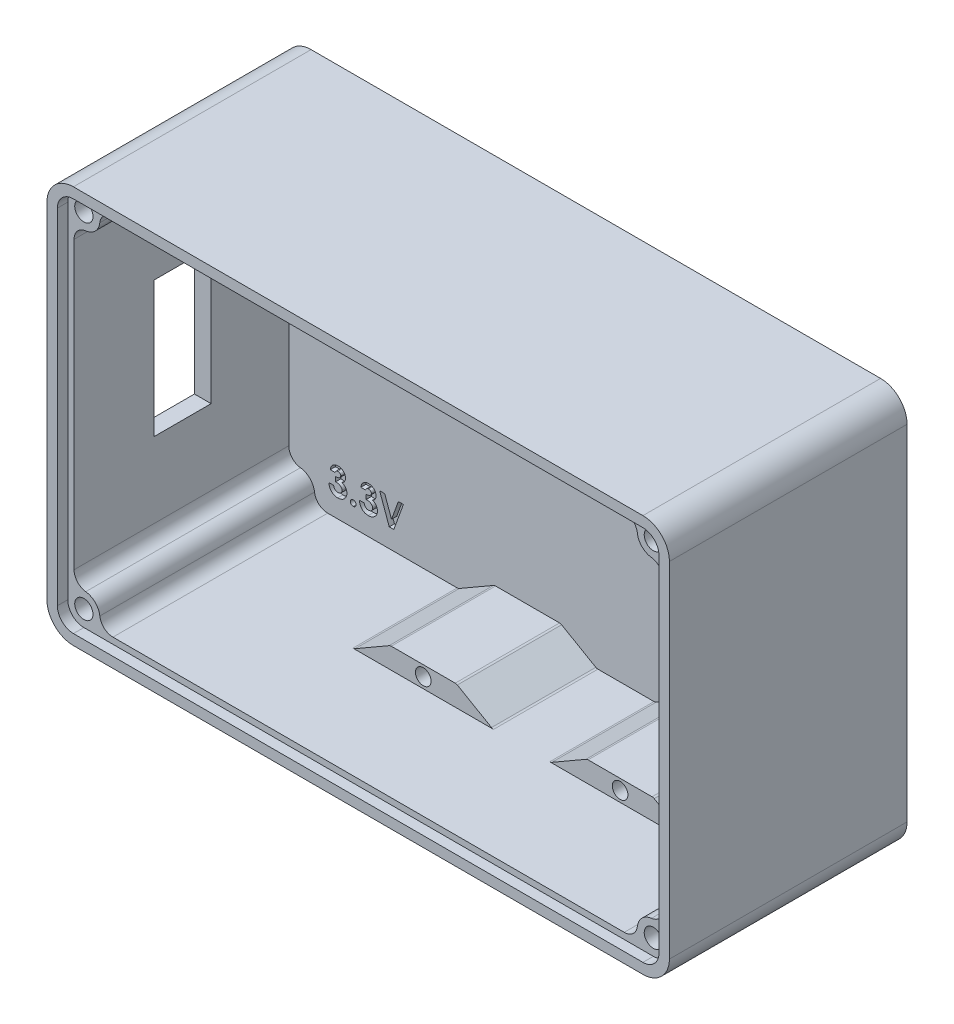
from build123d import *

# Parameters (mm, degrees)
ENCLOSURE_BASE_DEPTH    = 2.400000026
ENCLOSURE_START         = 2.4
ENCLOSURE_WALL_DEPTH    = 43.18
SKETCH7_W               = 11.000000098
SKETCH7_H               = 26.00000007
POWER_SWITCH_HOLE_DEPTH = 7.112
SKETCH8_W               = 0.569871795
SKETCH8_H               = 2.320192308
LABELING_DEPTH          = 1.000000032
TOP_START               = -2.000000064
TOP_COVER_GROOVE_DEPTH  = 2.000000064
SKETCH10_R              = 3.079999936
SKETCH10_R_2            = 1.750000056
BOSS_EXTRUDE4_DEPTH     = 43.579999962
FILLET1_R               = 2.54
SKETCH12_R              = 1.500000048
BOSS_EXTRUDE5_DEPTH     = 19.999999878
BOSS_EXTRUDE6_DEPTH     = 20.066
FILLET4_R               = 0.799999924


with BuildPart() as part:
    # Sketch5 → Enclosure Base (new body)
    with BuildSketch(Plane.XY):
        with BuildLine():
            Line((42.610000124, -38.1), (-66.609999876, -38.1))
            ThreePointArc((-66.609999876, -38.1), (-70.202102324, -36.612102448), (-71.689999876, -33.02))
            Line((-71.689999876, -33.02), (-71.689999876, 33.02))
            ThreePointArc((-71.689999876, 33.02), (-70.202102324, 36.612102448), (-66.609999876, 38.1))
            Line((-66.609999876, 38.1), (42.610000124, 38.1))
            ThreePointArc((42.610000124, 38.1), (46.202102572, 36.612102448), (47.690000124, 33.02))
            Line((47.690000124, 33.02), (47.690000124, -33.02))
            ThreePointArc((47.690000124, -33.02), (46.202102572, -36.612102448), (42.610000124, -38.1))
        make_face()
    extrude(amount=ENCLOSURE_BASE_DEPTH)

    # Sketch5<3> → Enclosure Wall (add)
    with BuildSketch(Plane.XY.offset(ENCLOSURE_START)):
        with BuildLine():
            Line((42.610000124, 38.1), (-66.609999876, 38.1))
            ThreePointArc((-66.609999876, 38.1), (-70.202102324, 36.612102448), (-71.689999876, 33.02))
            Line((-71.689999876, 33.02), (-71.689999876, -33.02))
            ThreePointArc((-71.689999876, -33.02), (-70.202102324, -36.612102448), (-66.609999876, -38.1))
            Line((-66.609999876, -38.1), (42.610000124, -38.1))
            ThreePointArc((42.610000124, -38.1), (46.202102572, -36.612102448), (47.690000124, -33.02))
            Line((47.690000124, -33.02), (47.690000124, 33.02))
            ThreePointArc((47.690000124, 33.02), (46.202102572, 36.612102448), (42.610000124, 38.1))
        make_face()
        with BuildLine():
            ThreePointArc((44.490000174, 33.02), (43.939360908, 34.349360784), (42.610000124, 34.90000005))
            Line((42.610000124, 34.90000005), (-66.609999876, 34.90000005))
            ThreePointArc((-66.609999876, 34.90000005), (-67.93936066, 34.349360784), (-68.489999926, 33.02))
            Line((-68.489999926, 33.02), (-68.489999926, -33.02))
            ThreePointArc((-68.489999926, -33.02), (-67.93936066, -34.349360784), (-66.609999876, -34.90000005))
            Line((-66.609999876, -34.90000005), (42.610000124, -34.90000005))
            ThreePointArc((42.610000124, -34.90000005), (43.939360908, -34.349360784), (44.490000174, -33.02))
            Line((44.490000174, -33.02), (44.490000174, 33.02))
        make_face(mode=Mode.SUBTRACT)
    extrude(amount=ENCLOSURE_WALL_DEPTH)

    # Sketch7 → Power Switch Hole (cut)
    with BuildSketch(Plane.ZY.offset(71.689999876)):
        with Locations((22.790000013, 0)):
            Rectangle(SKETCH7_W, SKETCH7_H)
    extrude(amount=-POWER_SWITCH_HOLE_DEPTH, mode=Mode.SUBTRACT)

    # Sketch8 → Labeling (cut)
    # profile 1 of 12: a face of its own
    with BuildSketch(Plane.XY.offset(2.400000026)):
        with BuildLine():
            Line((-59.62574043, -27.429839852), (-60.537535302, -27.429839852))
            add(Edge.make_bspline(
                [(-60.537535302, -27.429839852), (-60.531097683, -27.384262479), (-60.518477158, -27.294911058), (-60.48827793, -27.16555246), (-60.452156395, -27.042846977), (-60.407060504, -26.927183192), (-60.35417036, -26.818355069), (-60.294023796, -26.715989164), (-60.225970607, -26.62052485), (-60.173807117, -26.563016768), (-60.147783699, -26.534327031)],
                knots=[0, 0, 0, 0, 1.111473889, 2.178970933, 3.205615836, 4.199322666, 5.174200091, 6.12565194, 7.064921805, 8, 8, 8, 8], degree=3))
            add(Edge.make_bspline(
                [(-60.147783699, -26.534327031), (-60.110248367, -26.496473002), (-60.036270173, -26.421866688), (-59.912643935, -26.326304242), (-59.783060806, -26.243601443), (-59.64492194, -26.178034066), (-59.500376882, -26.12496487), (-59.34827616, -26.089318171), (-59.189241312, -26.065666272), (-59.080720035, -26.063336478), (-59.025339789, -26.062147544)],
                knots=[0, 0, 0, 0, 1.01925491, 2.00884431, 2.983262333, 3.955970413, 4.92937149, 5.924503185, 6.940838805, 8, 8, 8, 8], degree=3))
            add(Edge.make_bspline(
                [(-59.025339789, -26.062147544), (-58.9761039, -26.063309907), (-58.879316064, -26.065594878), (-58.7370623, -26.083937386), (-58.60143524, -26.116108103), (-58.471001267, -26.158170594), (-58.34767864, -26.215403643), (-58.228745509, -26.28183903), (-58.11752487, -26.363324794), (-58.013756487, -26.455395506), (-57.918425437, -26.554978995), (-57.835868329, -26.661425555), (-57.764892503, -26.771891752), (-57.70641781, -26.887295353), (-57.661458717, -27.007831635), (-57.630255773, -27.132804274), (-57.609832689, -27.26193751), (-57.607798016, -27.349707632), (-57.606766071, -27.394222864)],
                knots=[0, 0, 0, 0, 1.091422571, 2.145516843, 3.172569842, 4.178562979, 5.178154469, 6.181868002, 7.194278174, 8.227918432, 9.254613415, 10.245994977, 11.209837596, 12.161663635, 13.10878368, 14.055455738, 15.013766427, 16, 16, 16, 16], degree=3))
            add(Edge.make_bspline(
                [(-57.606766071, -27.394222864), (-57.608883684, -27.449351273), (-57.613052612, -27.557882161), (-57.647261688, -27.71672518), (-57.700808195, -27.868607452), (-57.778161332, -28.011403916), (-57.874872454, -28.144725961), (-57.993533763, -28.264116231), (-58.130765475, -28.371446603), (-58.233787149, -28.429125958), (-58.286541712, -28.458661967)],
                knots=[0, 0, 0, 0, 0.992805628, 1.954529043, 2.915727527, 3.886831945, 4.871318353, 5.87440735, 6.911542536, 8, 8, 8, 8], degree=3))
            add(Edge.make_bspline(
                [(-58.286541712, -28.458661967), (-58.250331789, -28.470550447), (-58.179180916, -28.493910777), (-58.078048504, -28.539918682), (-57.981883137, -28.590197697), (-57.892340747, -28.648608658), (-57.808530727, -28.712789685), (-57.730963993, -28.78328942), (-57.659177102, -28.859954142), (-57.594341945, -28.943205477), (-57.53679821, -29.031711982), (-57.485167281, -29.12342921), (-57.442672148, -29.219748068), (-57.40667348, -29.31956853), (-57.379266144, -29.423787731), (-57.35996893, -29.532001829), (-57.348814667, -29.64396398), (-57.347113452, -29.71981827), (-57.34625325, -29.758173185)],
                knots=[0, 0, 0, 0, 1.059543567, 2.081955587, 3.086750234, 4.076226789, 5.052108497, 6.020845489, 6.989030705, 7.970690546, 8.952259656, 9.923888338, 10.895517021, 11.877585046, 12.873342345, 13.889638361, 14.932918083, 16, 16, 16, 16], degree=3))
            add(Edge.make_bspline(
                [(-57.34625325, -29.758173185), (-57.347996994, -29.814539337), (-57.351435302, -29.92568191), (-57.373294455, -30.089383546), (-57.413992258, -30.245458511), (-57.467532473, -30.395702684), (-57.538949309, -30.538176467), (-57.622994918, -30.67614944), (-57.726303858, -30.804836737), (-57.841114006, -30.927640517), (-57.968617369, -31.039288215), (-58.106851757, -31.136081745), (-58.252777515, -31.219147816), (-58.407317873, -31.286583219), (-58.570419141, -31.338516191), (-58.74171778, -31.376055738), (-58.92193354, -31.399023054), (-59.044944896, -31.401430741), (-59.107767673, -31.402660364)],
                knots=[0, 0, 0, 0, 1.005138573, 1.981928558, 2.936866704, 3.876260664, 4.820238198, 5.773547, 6.751179199, 7.756627054, 8.768222608, 9.766606018, 10.760583154, 11.757261445, 12.767156078, 13.807575856, 14.880313354, 16, 16, 16, 16], degree=3))
            add(Edge.make_bspline(
                [(-59.107767673, -31.402660364), (-59.167197007, -31.401363935), (-59.283403205, -31.398828938), (-59.453379091, -31.376887255), (-59.614925081, -31.34149354), (-59.768453442, -31.291603163), (-59.913370188, -31.226903871), (-60.050989479, -31.149861531), (-60.178565151, -31.056032521), (-60.29751865, -30.949652458), (-60.405211228, -30.830300068), (-60.501463032, -30.70074009), (-60.584151692, -30.560479859), (-60.653616316, -30.410118627), (-60.709313848, -30.249392613), (-60.753247897, -30.078628664), (-60.78393655, -29.897493158), (-60.793282843, -29.772868077), (-60.798048122, -29.709327031)],
                knots=[0, 0, 0, 0, 1.066544725, 2.085487077, 3.070979577, 4.031932826, 4.977951092, 5.916076795, 6.857635327, 7.814973522, 8.776389752, 9.738577119, 10.707772778, 11.69409279, 12.707140348, 13.757286496, 14.856535458, 16, 16, 16, 16], degree=3))
            Line((-60.798048122, -29.709327031), (-59.88625325, -29.709327031))
            add(Edge.make_bspline(
                [(-59.88625325, -29.709327031), (-59.880475301, -29.741276303), (-59.86922123, -29.803505889), (-59.847270855, -29.893600495), (-59.818666454, -29.976763381), (-59.785592649, -30.053733697), (-59.749867961, -30.125522035), (-59.706703994, -30.189477076), (-59.659263578, -30.24733546), (-59.590806712, -30.316118144), (-59.492942907, -30.386789481), (-59.360794349, -30.448206235), (-59.213791591, -30.484203999), (-59.111022003, -30.488595615), (-59.057903891, -30.490865493)],
                knots=[0, 0, 0, 0, 0.928156231, 1.807827665, 2.648129825, 3.438902246, 4.202261636, 4.936546065, 5.639352463, 6.338805438, 7.70633318, 9.064371875, 10.482673459, 12, 12, 12, 12], degree=3))
            add(Edge.make_bspline(
                [(-59.057903891, -30.490865493), (-59.029717544, -30.490382144), (-58.974506794, -30.489435371), (-58.893410424, -30.478941664), (-58.816154713, -30.46165852), (-58.742595769, -30.438171369), (-58.67226531, -30.408728756), (-58.60650707, -30.370764269), (-58.543980732, -30.326625133), (-58.485366015, -30.277001026), (-58.431204808, -30.222928514), (-58.386139499, -30.163052394), (-58.344953068, -30.102207553), (-58.314491286, -30.036413309), (-58.287800203, -29.969210095), (-58.271463896, -29.898158644), (-58.259128812, -29.824749425), (-58.258411946, -29.774511378), (-58.258048122, -29.749014531)],
                knots=[0, 0, 0, 0, 1.110435564, 2.175094844, 3.216326037, 4.226890168, 5.215276772, 6.21526065, 7.213097102, 8.228249917, 9.239874822, 10.221364777, 11.178138315, 12.128914389, 13.072518965, 14.022636769, 14.996447288, 16, 16, 16, 16], degree=3))
            add(Edge.make_bspline(
                [(-58.258048122, -29.749014531), (-58.259014007, -29.721129385), (-58.260936863, -29.665616448), (-58.276646794, -29.584606989), (-58.301456096, -29.506682419), (-58.335919247, -29.432187824), (-58.381940944, -29.361397776), (-58.436246032, -29.292892012), (-58.503112857, -29.230236137), (-58.576474717, -29.168302702), (-58.661545656, -29.114315427), (-58.754182598, -29.064493103), (-58.856820186, -29.024849916), (-58.966952945, -28.989441206), (-59.086664139, -28.963579235), (-59.215210405, -28.944800923), (-59.352384381, -28.93082338), (-59.446940185, -28.928818071), (-59.49548402, -28.92778857)],
                knots=[0, 0, 0, 0, 0.809814727, 1.612155564, 2.388397, 3.182215007, 3.988903953, 4.837162975, 5.715530372, 6.646997145, 7.623086902, 8.637258368, 9.698941581, 10.815059213, 11.996518529, 13.252603015, 14.589518788, 16, 16, 16, 16], degree=3))
            Line((-59.49548402, -28.92778857), (-59.49548402, -28.081121903))
            add(Edge.make_bspline(
                [(-59.49548402, -28.081121903), (-59.435044058, -28.075974642), (-59.32197286, -28.066345137), (-59.165023974, -28.043826205), (-59.032893244, -28.013725945), (-58.922404905, -27.977411609), (-58.830662468, -27.930774542), (-58.750516781, -27.87928928), (-58.681491525, -27.819496671), (-58.623155924, -27.753179725), (-58.576489258, -27.681961543), (-58.54346131, -27.606949067), (-58.521651379, -27.530463277), (-58.51958489, -27.478149301), (-58.518560943, -27.452227672)],
                knots=[0, 0, 0, 0, 1.70044513, 3.18119609, 4.440695891, 5.496282586, 6.431922213, 7.318171381, 8.16090191, 8.983045123, 9.787564368, 10.536848927, 11.275007137, 12, 12, 12, 12], degree=3))
            add(Edge.make_bspline(
                [(-58.518560943, -27.452227672), (-58.520327545, -27.419154488), (-58.52377558, -27.354602636), (-58.550554883, -27.262215336), (-58.597040719, -27.179859715), (-58.659370062, -27.107709074), (-58.735320534, -27.047443451), (-58.824347801, -27.003691636), (-58.924519967, -26.977985491), (-58.994996484, -26.97532063), (-59.031445558, -26.973942416)],
                knots=[0, 0, 0, 0, 1.009664648, 1.970651636, 2.907870547, 3.878035693, 4.867062054, 5.849714035, 6.887914197, 8, 8, 8, 8], degree=3))
            add(Edge.make_bspline(
                [(-59.031445558, -26.973942416), (-59.064482546, -26.975568563), (-59.130038049, -26.978795338), (-59.225899815, -27.00287913), (-59.316936555, -27.043421198), (-59.401263156, -27.099326319), (-59.477662344, -27.166466), (-59.540364036, -27.245979016), (-59.59251633, -27.333101604), (-59.614622314, -27.397467356), (-59.62574043, -27.429839852)],
                knots=[0, 0, 0, 0, 0.98818071, 1.960853194, 2.938124878, 3.957524365, 4.978590984, 5.968022688, 6.978025184, 8, 8, 8, 8], degree=3))
        make_face()
    # profile 2 of 12: a face of its own
    with BuildSketch(Plane.XY.offset(2.400000026)):
        with BuildLine():
            add(Edge.make_bspline(
                [(-56.141381456, -30.230352672), (-56.104573378, -30.232370771), (-56.032104629, -30.236344058), (-55.927397169, -30.265996286), (-55.832898083, -30.319270738), (-55.748403274, -30.388758027), (-55.676956591, -30.472360513), (-55.625316544, -30.567698927), (-55.593158992, -30.672002935), (-55.589608775, -30.744699679), (-55.587791712, -30.781907159)],
                knots=[0, 0, 0, 0, 1.016957001, 2.002212695, 2.9757545, 3.99499976, 5.013036768, 5.994806404, 6.97370641, 8, 8, 8, 8], degree=3))
            add(Edge.make_bspline(
                [(-55.587791712, -30.781907159), (-55.589596872, -30.819120616), (-55.593123831, -30.891829035), (-55.625539071, -30.996336287), (-55.676879424, -31.092458295), (-55.748409006, -31.176956637), (-55.832548161, -31.247753479), (-55.927614439, -31.300536663), (-56.031905164, -31.331870986), (-56.104538269, -31.335626946), (-56.141381456, -31.337532159)],
                knots=[0, 0, 0, 0, 1.023218912, 1.999186227, 2.986238111, 4.008388923, 5.030539734, 6.0011649, 6.986089706, 8, 8, 8, 8], degree=3))
            add(Edge.make_bspline(
                [(-56.141381456, -31.337532159), (-56.178233372, -31.335642439), (-56.250883688, -31.331917021), (-56.355336525, -31.300272545), (-56.451104656, -31.24810588), (-56.535264951, -31.176870761), (-56.607114096, -31.092757511), (-56.656994795, -30.996033005), (-56.689711974, -30.891868435), (-56.693190717, -30.819133955), (-56.694971199, -30.781907159)],
                knots=[0, 0, 0, 0, 1.013427518, 1.99788335, 2.976245624, 3.997909735, 5.019573847, 6.001765691, 6.977268297, 8, 8, 8, 8], degree=3))
            add(Edge.make_bspline(
                [(-56.694971199, -30.781907159), (-56.69317897, -30.744686108), (-56.689677277, -30.671962848), (-56.657216688, -30.568005702), (-56.607034153, -30.472059671), (-56.535270943, -30.388844082), (-56.450752931, -30.318921088), (-56.355555014, -30.266256784), (-56.250684323, -30.236297683), (-56.178198305, -30.23235515), (-56.141381456, -30.230352672)],
                knots=[0, 0, 0, 0, 1.025808215, 2.00424526, 2.981110158, 3.998665696, 5.017428914, 5.998734231, 6.983523959, 8, 8, 8, 8], degree=3))
        make_face()
    # profile 3 of 12: a face of its own
    with BuildSketch(Plane.XY.offset(2.400000026)):
        with BuildLine():
            Line((-53.764201968, -27.429839852), (-54.67599684, -27.429839852))
            add(Edge.make_bspline(
                [(-54.67599684, -27.429839852), (-54.669559222, -27.384262479), (-54.656938697, -27.294911058), (-54.626739469, -27.16555246), (-54.590617934, -27.042846977), (-54.545522042, -26.927183192), (-54.492631898, -26.818355069), (-54.432485335, -26.715989164), (-54.364432146, -26.62052485), (-54.312268655, -26.563016768), (-54.286245238, -26.534327031)],
                knots=[0, 0, 0, 0, 1.111473889, 2.178970933, 3.205615836, 4.199322666, 5.174200091, 6.12565194, 7.064921805, 8, 8, 8, 8], degree=3))
            add(Edge.make_bspline(
                [(-54.286245238, -26.534327031), (-54.248709906, -26.496473002), (-54.174731712, -26.421866688), (-54.051105473, -26.326304242), (-53.921522344, -26.243601443), (-53.783383478, -26.178034066), (-53.638838421, -26.12496487), (-53.486737698, -26.089318171), (-53.327702851, -26.065666272), (-53.219181574, -26.063336478), (-53.163801327, -26.062147544)],
                knots=[0, 0, 0, 0, 1.01925491, 2.00884431, 2.983262333, 3.955970413, 4.92937149, 5.924503185, 6.940838805, 8, 8, 8, 8], degree=3))
            add(Edge.make_bspline(
                [(-53.163801327, -26.062147544), (-53.114565439, -26.063309907), (-53.017777603, -26.065594878), (-52.875523838, -26.083937386), (-52.739896778, -26.116108103), (-52.609462805, -26.158170594), (-52.486140178, -26.215403643), (-52.367207047, -26.28183903), (-52.255986408, -26.363324794), (-52.152218026, -26.455395506), (-52.056886975, -26.554978995), (-51.974329868, -26.661425555), (-51.903354041, -26.771891752), (-51.844879348, -26.887295353), (-51.799920255, -27.007831635), (-51.768717311, -27.132804274), (-51.748294227, -27.26193751), (-51.746259554, -27.349707632), (-51.745227609, -27.394222864)],
                knots=[0, 0, 0, 0, 1.091422571, 2.145516843, 3.172569842, 4.178562979, 5.178154469, 6.181868002, 7.194278174, 8.227918432, 9.254613415, 10.245994977, 11.209837596, 12.161663635, 13.10878368, 14.055455738, 15.013766427, 16, 16, 16, 16], degree=3))
            add(Edge.make_bspline(
                [(-51.745227609, -27.394222864), (-51.747345222, -27.449351273), (-51.751514151, -27.557882161), (-51.785723227, -27.71672518), (-51.839269733, -27.868607452), (-51.91662287, -28.011403916), (-52.013333993, -28.144725961), (-52.131995301, -28.264116231), (-52.269227014, -28.371446603), (-52.372248688, -28.429125958), (-52.42500325, -28.458661967)],
                knots=[0, 0, 0, 0, 0.992805628, 1.954529043, 2.915727527, 3.886831945, 4.871318353, 5.87440735, 6.911542536, 8, 8, 8, 8], degree=3))
            add(Edge.make_bspline(
                [(-52.42500325, -28.458661967), (-52.388793328, -28.470550447), (-52.317642454, -28.493910777), (-52.216510043, -28.539918682), (-52.120344675, -28.590197697), (-52.030802285, -28.648608658), (-51.946992265, -28.712789685), (-51.869425532, -28.78328942), (-51.79763864, -28.859954142), (-51.732803484, -28.943205477), (-51.675259749, -29.031711982), (-51.623628819, -29.12342921), (-51.581133687, -29.219748068), (-51.545135019, -29.31956853), (-51.517727683, -29.423787731), (-51.498430469, -29.532001829), (-51.487276206, -29.64396398), (-51.48557499, -29.71981827), (-51.484714789, -29.758173185)],
                knots=[0, 0, 0, 0, 1.059543567, 2.081955587, 3.086750234, 4.076226789, 5.052108497, 6.020845489, 6.989030705, 7.970690546, 8.952259656, 9.923888338, 10.895517021, 11.877585046, 12.873342345, 13.889638361, 14.932918083, 16, 16, 16, 16], degree=3))
            add(Edge.make_bspline(
                [(-51.484714789, -29.758173185), (-51.486458533, -29.814539337), (-51.489896841, -29.92568191), (-51.511755993, -30.089383546), (-51.552453797, -30.245458511), (-51.605994011, -30.395702684), (-51.677410847, -30.538176467), (-51.761456456, -30.67614944), (-51.864765396, -30.804836737), (-51.979575545, -30.927640517), (-52.107078908, -31.039288215), (-52.245313296, -31.136081745), (-52.391239053, -31.219147816), (-52.545779412, -31.286583219), (-52.708880679, -31.338516191), (-52.880179318, -31.376055738), (-53.060395079, -31.399023054), (-53.183406435, -31.401430741), (-53.246229212, -31.402660364)],
                knots=[0, 0, 0, 0, 1.005138573, 1.981928558, 2.936866704, 3.876260664, 4.820238198, 5.773547, 6.751179199, 7.756627054, 8.768222608, 9.766606018, 10.760583154, 11.757261445, 12.767156078, 13.807575856, 14.880313354, 16, 16, 16, 16], degree=3))
            add(Edge.make_bspline(
                [(-53.246229212, -31.402660364), (-53.305658546, -31.401363935), (-53.421864744, -31.398828938), (-53.591840629, -31.376887255), (-53.753386619, -31.34149354), (-53.906914981, -31.291603163), (-54.051831727, -31.226903871), (-54.189451017, -31.149861531), (-54.31702669, -31.056032521), (-54.435980189, -30.949652458), (-54.543672767, -30.830300068), (-54.63992457, -30.70074009), (-54.72261323, -30.560479859), (-54.792077855, -30.410118627), (-54.847775386, -30.249392613), (-54.891709436, -30.078628664), (-54.922398088, -29.897493158), (-54.931744382, -29.772868077), (-54.936509661, -29.709327031)],
                knots=[0, 0, 0, 0, 1.066544725, 2.085487077, 3.070979577, 4.031932826, 4.977951092, 5.916076795, 6.857635327, 7.814973522, 8.776389752, 9.738577119, 10.707772778, 11.69409279, 12.707140348, 13.757286496, 14.856535458, 16, 16, 16, 16], degree=3))
            Line((-54.936509661, -29.709327031), (-54.024714789, -29.709327031))
            add(Edge.make_bspline(
                [(-54.024714789, -29.709327031), (-54.01893684, -29.741276303), (-54.007682769, -29.803505889), (-53.985732394, -29.893600495), (-53.957127992, -29.976763381), (-53.924054188, -30.053733697), (-53.888329499, -30.125522035), (-53.845165533, -30.189477076), (-53.797725117, -30.24733546), (-53.729268251, -30.316118144), (-53.631404446, -30.386789481), (-53.499255887, -30.448206235), (-53.35225313, -30.484203999), (-53.249483542, -30.488595615), (-53.19636543, -30.490865493)],
                knots=[0, 0, 0, 0, 0.928156231, 1.807827665, 2.648129825, 3.438902246, 4.202261636, 4.936546065, 5.639352463, 6.338805438, 7.70633318, 9.064371875, 10.482673459, 12, 12, 12, 12], degree=3))
            add(Edge.make_bspline(
                [(-53.19636543, -30.490865493), (-53.168179082, -30.490382144), (-53.112968333, -30.489435371), (-53.031871963, -30.478941664), (-52.954616252, -30.46165852), (-52.881057307, -30.438171369), (-52.810726848, -30.408728756), (-52.744968608, -30.370764269), (-52.682442271, -30.326625133), (-52.623827554, -30.277001026), (-52.569666347, -30.222928514), (-52.524601038, -30.163052394), (-52.483414606, -30.102207553), (-52.452952825, -30.036413309), (-52.426261741, -29.969210095), (-52.409925435, -29.898158644), (-52.39759035, -29.824749425), (-52.396873485, -29.774511378), (-52.396509661, -29.749014531)],
                knots=[0, 0, 0, 0, 1.110435564, 2.175094844, 3.216326037, 4.226890168, 5.215276772, 6.21526065, 7.213097102, 8.228249917, 9.239874822, 10.221364777, 11.178138315, 12.128914389, 13.072518965, 14.022636769, 14.996447288, 16, 16, 16, 16], degree=3))
            add(Edge.make_bspline(
                [(-52.396509661, -29.749014531), (-52.397475546, -29.721129385), (-52.399398401, -29.665616448), (-52.415108332, -29.584606989), (-52.439917634, -29.506682419), (-52.474380785, -29.432187824), (-52.520402482, -29.361397776), (-52.574707571, -29.292892012), (-52.641574395, -29.230236137), (-52.714936256, -29.168302702), (-52.800007194, -29.114315427), (-52.892644136, -29.064493103), (-52.995281724, -29.024849916), (-53.105414483, -28.989441206), (-53.225125677, -28.963579235), (-53.353671944, -28.944800923), (-53.490845919, -28.93082338), (-53.585401723, -28.928818071), (-53.633945558, -28.92778857)],
                knots=[0, 0, 0, 0, 0.809814727, 1.612155564, 2.388397, 3.182215007, 3.988903953, 4.837162975, 5.715530372, 6.646997145, 7.623086902, 8.637258368, 9.698941581, 10.815059213, 11.996518529, 13.252603015, 14.589518788, 16, 16, 16, 16], degree=3))
            Line((-53.633945558, -28.92778857), (-53.633945558, -28.081121903))
            add(Edge.make_bspline(
                [(-53.633945558, -28.081121903), (-53.573505597, -28.075974642), (-53.460434399, -28.066345137), (-53.303485513, -28.043826205), (-53.171354783, -28.013725945), (-53.060866444, -27.977411609), (-52.969124006, -27.930774542), (-52.88897832, -27.87928928), (-52.819953063, -27.819496671), (-52.761617462, -27.753179725), (-52.714950796, -27.681961543), (-52.681922849, -27.606949067), (-52.660112918, -27.530463277), (-52.658046429, -27.478149301), (-52.657022481, -27.452227672)],
                knots=[0, 0, 0, 0, 1.70044513, 3.18119609, 4.440695891, 5.496282586, 6.431922213, 7.318171381, 8.16090191, 8.983045123, 9.787564368, 10.536848927, 11.275007137, 12, 12, 12, 12], degree=3))
            add(Edge.make_bspline(
                [(-52.657022481, -27.452227672), (-52.658789084, -27.419154488), (-52.662237118, -27.354602636), (-52.689016421, -27.262215336), (-52.735502257, -27.179859715), (-52.7978316, -27.107709074), (-52.873782072, -27.047443451), (-52.96280934, -27.003691636), (-53.062981506, -26.977985491), (-53.133458022, -26.97532063), (-53.169907097, -26.973942416)],
                knots=[0, 0, 0, 0, 1.009664648, 1.970651636, 2.907870547, 3.878035693, 4.867062054, 5.849714035, 6.887914197, 8, 8, 8, 8], degree=3))
            add(Edge.make_bspline(
                [(-53.169907097, -26.973942416), (-53.202944084, -26.975568563), (-53.268499587, -26.978795338), (-53.364361353, -27.00287913), (-53.455398094, -27.043421198), (-53.539724694, -27.099326319), (-53.616123883, -27.166466), (-53.678825574, -27.245979016), (-53.730977868, -27.333101604), (-53.753083853, -27.397467356), (-53.764201968, -27.429839852)],
                knots=[0, 0, 0, 0, 0.98818071, 1.960853194, 2.938124878, 3.957524365, 4.978590984, 5.968022688, 6.978025184, 8, 8, 8, 8], degree=3))
        make_face()
    # profile 4 of 12: a face of its own
    with BuildSketch(Plane.XY.offset(2.400000026)):
        Polygon((-51.061381456, -26.192403954), (-50.087511263, -26.192403954), (-48.781894276, -29.80091357), (-47.473224404, -26.192403954), (-46.502407097, -26.192403954), (-48.344314148, -31.272403954), (-49.222527289, -31.272403954), align=None)
    # profile 5 of 12: a face of its own
    with BuildSketch(Plane.XY.offset(2.400000026)):
        with BuildLine():
            Line((-59.854706776, 30.957596046), (-57.541637866, 30.957596046))
            Line((-57.541637866, 30.957596046), (-57.541637866, 30.110929379))
            Line((-57.541637866, 30.110929379), (-59.13219075, 30.110929379))
            Line((-59.13219075, 30.110929379), (-59.33062825, 29.150288354))
            add(Edge.make_bspline(
                [(-59.33062825, 29.150288354), (-59.3035883, 29.157819321), (-59.250259963, 29.172671936), (-59.169920758, 29.18756723), (-59.092060871, 29.197221886), (-59.040969689, 29.198509688), (-59.016181135, 29.199134507)],
                knots=[0, 0, 0, 0, 1.05461699, 2.079921384, 3.068411212, 4, 4, 4, 4], degree=3))
            add(Edge.make_bspline(
                [(-59.016181135, 29.199134507), (-58.962164279, 29.197896742), (-58.855685156, 29.195456835), (-58.699919711, 29.172294155), (-58.550765096, 29.135813637), (-58.40867774, 29.083784891), (-58.273796444, 29.016068134), (-58.145957704, 28.934149841), (-58.025004621, 28.837886133), (-57.91308583, 28.727216741), (-57.81025017, 28.605699243), (-57.720840429, 28.47426521), (-57.64447893, 28.334788765), (-57.583743634, 28.186402925), (-57.535806161, 28.030039653), (-57.501165472, 27.865598746), (-57.480680702, 27.692885317), (-57.477918456, 27.575055293), (-57.476509661, 27.514959828)],
                knots=[0, 0, 0, 0, 1.01440847, 1.999622559, 2.951875003, 3.895578053, 4.836219714, 5.782137149, 6.743708247, 7.735272588, 8.734977101, 9.730283169, 10.717124674, 11.717316708, 12.737475749, 13.78628267, 14.87096371, 16, 16, 16, 16], degree=3))
            add(Edge.make_bspline(
                [(-57.476509661, 27.514959828), (-57.478231232, 27.45418214), (-57.481628395, 27.334249995), (-57.50379177, 27.15790732), (-57.542910525, 26.989010847), (-57.596644048, 26.827108443), (-57.667434527, 26.673390055), (-57.752569765, 26.526263273), (-57.853489171, 26.386820173), (-57.96920238, 26.256490216), (-58.094997817, 26.137366133), (-58.228940262, 26.032572448), (-58.370088729, 25.944389412), (-58.518446624, 25.87312261), (-58.673162772, 25.816737586), (-58.834284128, 25.775691979), (-59.002593724, 25.752154604), (-59.116854071, 25.748962262), (-59.174931135, 25.747339636)],
                knots=[0, 0, 0, 0, 1.06808661, 2.107647099, 3.116961351, 4.110378221, 5.100014249, 6.085620622, 7.093190682, 8.119403071, 9.144090782, 10.133780668, 11.103064255, 12.062861538, 13.020824475, 13.992378307, 14.979551724, 16, 16, 16, 16], degree=3))
            add(Edge.make_bspline(
                [(-59.174931135, 25.747339636), (-59.226867725, 25.748667045), (-59.329297549, 25.751284974), (-59.480172183, 25.767376146), (-59.625632084, 25.795825489), (-59.76490502, 25.836999055), (-59.899456374, 25.887674315), (-60.027730694, 25.951053304), (-60.150432871, 26.025929201), (-60.267214475, 26.11093552), (-60.376177972, 26.20669184), (-60.475628307, 26.311513632), (-60.566167563, 26.424079666), (-60.645858343, 26.545778666), (-60.71445084, 26.676430829), (-60.775280066, 26.814496388), (-60.825069397, 26.961417189), (-60.850336048, 27.063270851), (-60.863176327, 27.115031943)],
                knots=[0, 0, 0, 0, 1.054957082, 2.080596141, 3.077793124, 4.061112343, 5.027190972, 5.994718051, 6.962465889, 7.943658696, 8.924948258, 9.904494768, 10.875059, 11.855380583, 12.854004648, 13.869083016, 14.917087635, 16, 16, 16, 16], degree=3))
            Line((-60.863176327, 27.115031943), (-59.821125045, 27.115031943))
            add(Edge.make_bspline(
                [(-59.821125045, 27.115031943), (-59.802076323, 27.079163614), (-59.765057304, 27.00945761), (-59.694638947, 26.916912416), (-59.615810066, 26.83799385), (-59.529281742, 26.771930862), (-59.434493325, 26.722437595), (-59.335307263, 26.684904191), (-59.230477524, 26.663215027), (-59.159083843, 26.660503666), (-59.123032097, 26.659134507)],
                knots=[0, 0, 0, 0, 1.104910296, 2.147267069, 3.153527244, 4.136738762, 5.099945312, 6.05603338, 7.018353, 8, 8, 8, 8], degree=3))
            add(Edge.make_bspline(
                [(-59.123032097, 26.659134507), (-59.097904513, 26.660079923), (-59.048465568, 26.661940045), (-58.975625101, 26.671780558), (-58.906095675, 26.690418265), (-58.839360355, 26.716227157), (-58.775239874, 26.748413761), (-58.71465342, 26.789047251), (-58.656546899, 26.835817904), (-58.601804928, 26.889487387), (-58.55222448, 26.949316377), (-58.508747852, 27.013606705), (-58.46987375, 27.080929826), (-58.441079108, 27.153952578), (-58.417498731, 27.230494477), (-58.400133188, 27.3111329), (-58.389755318, 27.395962027), (-58.388794604, 27.453872495), (-58.388304532, 27.483413354)],
                knots=[0, 0, 0, 0, 0.978869489, 1.925942215, 2.855067702, 3.774946051, 4.70828698, 5.642468714, 6.60995405, 7.609372294, 8.622401667, 9.629904756, 10.629323, 11.642352373, 12.678539694, 13.745912462, 14.850161547, 16, 16, 16, 16], degree=3))
            add(Edge.make_bspline(
                [(-58.388304532, 27.483413354), (-58.388873318, 27.512268502), (-58.389980472, 27.568435749), (-58.399139071, 27.650909387), (-58.41552363, 27.729161944), (-58.437847731, 27.803792775), (-58.466425246, 27.874348687), (-58.501348879, 27.941249662), (-58.542767828, 28.00415754), (-58.590904463, 28.061791579), (-58.642236875, 28.114655158), (-58.69738438, 28.160889223), (-58.755850128, 28.199260287), (-58.815817369, 28.232759342), (-58.879679778, 28.257139225), (-58.946001347, 28.27392875), (-59.01471233, 28.286248228), (-59.0615786, 28.286972043), (-59.085379853, 28.287339636)],
                knots=[0, 0, 0, 0, 1.166249705, 2.270133367, 3.348514167, 4.393962215, 5.415026464, 6.420877785, 7.440098956, 8.453121383, 9.451844239, 10.415694839, 11.355045125, 12.27538808, 13.187007209, 14.108269027, 15.039275622, 16, 16, 16, 16], degree=3))
            add(Edge.make_bspline(
                [(-59.085379853, 28.287339636), (-59.111233546, 28.286358632), (-59.163049893, 28.284392489), (-59.240036016, 28.268394513), (-59.3160939, 28.242503786), (-59.391646505, 28.206783424), (-59.465943842, 28.160036742), (-59.540946653, 28.105208244), (-59.614144432, 28.038314119), (-59.660685617, 27.988491222), (-59.684762866, 27.962716238)],
                knots=[0, 0, 0, 0, 0.88288272, 1.769486374, 2.674910571, 3.623812639, 4.617874466, 5.670434592, 6.794841017, 8, 8, 8, 8], degree=3))
            Line((-59.684762866, 27.962716238), (-60.452054532, 28.138765918))
            Line((-60.452054532, 28.138765918), (-59.854706776, 30.957596046))
        make_face()
    # profile 6 of 12: a face of its own
    with BuildSketch(Plane.XY.offset(2.400000026)):
        with BuildLine():
            add(Edge.make_bspline(
                [(-56.141381456, 26.919647328), (-56.104573378, 26.917629229), (-56.032104629, 26.913655942), (-55.927397169, 26.884003714), (-55.832898083, 26.830729262), (-55.748403274, 26.761241973), (-55.676956591, 26.677639487), (-55.625316544, 26.582301073), (-55.593158992, 26.477997065), (-55.589608775, 26.405300321), (-55.587791712, 26.368092841)],
                knots=[0, 0, 0, 0, 1.016957001, 2.002212695, 2.9757545, 3.99499976, 5.013036768, 5.994806404, 6.97370641, 8, 8, 8, 8], degree=3))
            add(Edge.make_bspline(
                [(-55.587791712, 26.368092841), (-55.589596872, 26.330879384), (-55.593123831, 26.258170965), (-55.625539071, 26.153663713), (-55.676879424, 26.057541705), (-55.748409006, 25.973043363), (-55.832548161, 25.902246521), (-55.927614439, 25.849463337), (-56.031905164, 25.818129014), (-56.104538269, 25.814373054), (-56.141381456, 25.812467841)],
                knots=[0, 0, 0, 0, 1.023218912, 1.999186227, 2.986238111, 4.008388923, 5.030539734, 6.0011649, 6.986089706, 8, 8, 8, 8], degree=3))
            add(Edge.make_bspline(
                [(-56.141381456, 25.812467841), (-56.178233372, 25.814357561), (-56.250883688, 25.818082979), (-56.355336525, 25.849727455), (-56.451104656, 25.90189412), (-56.535264951, 25.973129239), (-56.607114096, 26.057242489), (-56.656994795, 26.153966995), (-56.689711974, 26.258131565), (-56.693190717, 26.330866045), (-56.694971199, 26.368092841)],
                knots=[0, 0, 0, 0, 1.013427518, 1.99788335, 2.976245624, 3.997909735, 5.019573847, 6.001765691, 6.977268297, 8, 8, 8, 8], degree=3))
            add(Edge.make_bspline(
                [(-56.694971199, 26.368092841), (-56.69317897, 26.405313892), (-56.689677277, 26.478037152), (-56.657216688, 26.581994298), (-56.607034153, 26.677940329), (-56.535270943, 26.761155918), (-56.450752931, 26.831078912), (-56.355555014, 26.883743216), (-56.250684323, 26.913702317), (-56.178198305, 26.91764485), (-56.141381456, 26.919647328)],
                knots=[0, 0, 0, 0, 1.025808215, 2.00424526, 2.981110158, 3.998665696, 5.017428914, 5.998734231, 6.983523959, 8, 8, 8, 8], degree=3))
        make_face()
    # profile 7 of 12: a face of its own
    with BuildSketch(Plane.XY.offset(2.400000026)):
        with BuildLine():
            add(Edge.make_bspline(
                [(-53.225876648, 31.087852456), (-53.181741992, 31.087197265), (-53.094961466, 31.085908983), (-52.967150086, 31.071955847), (-52.84403239, 31.050876549), (-52.725126725, 31.021478279), (-52.611288987, 30.982570715), (-52.501690642, 30.935999029), (-52.397636226, 30.879320438), (-52.297798713, 30.81529906), (-52.202216561, 30.742817783), (-52.113187021, 30.660185385), (-52.029084222, 30.569303241), (-51.951728682, 30.468797376), (-51.879407338, 30.359581997), (-51.812357827, 30.241639786), (-51.751093428, 30.114393495), (-51.694927514, 29.977613498), (-51.644703776, 29.829249522), (-51.602400384, 29.667599768), (-51.566118147, 29.492627319), (-51.535493379, 29.303896644), (-51.512346004, 29.101156874), (-51.496744207, 28.884542699), (-51.486037515, 28.65447172), (-51.48516371, 28.496644919), (-51.484714789, 28.415560789)],
                knots=[0, 0, 0, 0, 0.879237366, 1.728815576, 2.559023295, 3.367336655, 4.166867292, 4.954216142, 5.737608147, 6.525189134, 7.316157332, 8.124696809, 8.942788509, 9.781158001, 10.649253743, 11.551476218, 12.482711956, 13.461909668, 14.496590415, 15.601789533, 16.789733467, 18.056700938, 19.410929216, 20.8549011, 22.384193279, 24, 24, 24, 24], degree=3))
            add(Edge.make_bspline(
                [(-51.484714789, 28.415560789), (-51.485199951, 28.333462206), (-51.486142613, 28.173946132), (-51.496299126, 27.941770807), (-51.513789123, 27.723583883), (-51.536331493, 27.519407934), (-51.567208374, 27.329350781), (-51.603369493, 27.152920305), (-51.646340631, 26.990180457), (-51.698218723, 26.841497924), (-51.754044663, 26.704477711), (-51.815476646, 26.57747952), (-51.881443922, 26.46015937), (-51.950433399, 26.350747325), (-52.026227335, 26.252468799), (-52.105136625, 26.161981806), (-52.19059712, 26.082733113), (-52.279010604, 26.010638597), (-52.373616019, 25.948334468), (-52.473437725, 25.893844303), (-52.58025537, 25.849646308), (-52.69212185, 25.811205253), (-52.810943951, 25.783608723), (-52.934833607, 25.761711783), (-53.065189506, 25.749610191), (-53.153941053, 25.748108909), (-53.199418314, 25.747339636)],
                knots=[0, 0, 0, 0, 1.643780988, 3.193836972, 4.651895693, 6.025988579, 7.305620092, 8.505800249, 9.631074763, 10.672816429, 11.65661981, 12.592235626, 13.49536222, 14.350718032, 15.179365177, 15.97804903, 16.751647189, 17.51006938, 18.259804725, 19.016521909, 19.783502495, 20.571750527, 21.382245291, 22.22305063, 23.089471752, 24, 24, 24, 24], degree=3))
            add(Edge.make_bspline(
                [(-53.199418314, 25.747339636), (-53.244894348, 25.748123748), (-53.333981229, 25.749659812), (-53.464689624, 25.761621803), (-53.589235833, 25.783697428), (-53.708998008, 25.811417118), (-53.823142623, 25.849561254), (-53.932216998, 25.895081621), (-54.035382447, 25.949231794), (-54.132924617, 26.011681086), (-54.224510472, 26.083293235), (-54.311563255, 26.163302268), (-54.393890402, 26.251505383), (-54.470239511, 26.348890528), (-54.54186096, 26.454157814), (-54.608007851, 26.568509343), (-54.668640431, 26.691778621), (-54.725655299, 26.824137473), (-54.775194002, 26.968435433), (-54.819281147, 27.125961065), (-54.855396177, 27.298027473), (-54.884442301, 27.48457938), (-54.907632709, 27.685221568), (-54.924883708, 27.90005088), (-54.935096636, 28.129167379), (-54.936029412, 28.286650562), (-54.936509661, 28.367732264)],
                knots=[0, 0, 0, 0, 0.917216111, 1.796812873, 2.643793957, 3.46689424, 4.273913431, 5.068098542, 5.848489301, 6.620921603, 7.401012384, 8.190319798, 9.003608147, 9.831726257, 10.68377682, 11.569763213, 12.493818149, 13.453288342, 14.474581811, 15.568529029, 16.750744269, 18.018426408, 19.375425659, 20.823733699, 22.36466933, 24, 24, 24, 24], degree=3))
            add(Edge.make_bspline(
                [(-54.936509661, 28.367732264), (-54.935639736, 28.480388906), (-54.933961204, 28.697761348), (-54.912689618, 29.011801326), (-54.881468324, 29.302076887), (-54.83561164, 29.568102469), (-54.778910485, 29.810863356), (-54.706301702, 30.028760364), (-54.623641885, 30.224808589), (-54.553205102, 30.340948737), (-54.519282097, 30.396882905)],
                knots=[0, 0, 0, 0, 1.288568992, 2.486310467, 3.599230591, 4.627010532, 5.572937695, 6.447898582, 7.252493626, 8, 8, 8, 8], degree=3))
            add(Edge.make_bspline(
                [(-54.519282097, 30.396882905), (-54.479838042, 30.451832614), (-54.402717143, 30.559270123), (-54.267869094, 30.700315489), (-54.122992424, 30.820944393), (-53.965111446, 30.918426895), (-53.796723115, 30.995301603), (-53.616381731, 31.049597344), (-53.424753265, 31.081232573), (-53.2931588, 31.085612877), (-53.225876648, 31.087852456)],
                knots=[0, 0, 0, 0, 1.058512271, 2.069600068, 3.047294572, 4.004278952, 4.967380941, 5.939006123, 6.946246673, 8, 8, 8, 8], degree=3))
        make_face()
        with BuildLine():
            add(Edge.make_bspline(
                [(-53.203488827, 30.176057584), (-53.243386922, 30.174166494), (-53.321608368, 30.170458953), (-53.435111413, 30.13898716), (-53.542137697, 30.09037728), (-53.623549733, 30.03188289), (-53.684485833, 29.975809001), (-53.727062322, 29.925063956), (-53.768120636, 29.868436143), (-53.804385406, 29.80337024), (-53.838628815, 29.732204141), (-53.872094948, 29.654614796), (-53.89952839, 29.568696441), (-53.926481018, 29.475912279), (-53.950094036, 29.373697073), (-53.969876568, 29.261215326), (-53.987550522, 29.13773556), (-53.999878315, 29.003176894), (-54.011371518, 28.857680112), (-54.01961039, 28.700921101), (-54.023054856, 28.532942154), (-54.024149747, 28.417257545), (-54.024714789, 28.357555982)],
                knots=[0, 0, 0, 0, 1.076674018, 2.110852608, 3.161083442, 4.239746716, 4.804137807, 5.395870207, 6.026861976, 6.692161227, 7.405688833, 8.16177676, 8.973626916, 9.841385931, 10.773283133, 11.807421078, 12.927755683, 14.143907515, 15.458935494, 16.872852025, 18.386167141, 20, 20, 20, 20], degree=3))
            add(Edge.make_bspline(
                [(-54.024714789, 28.357555982), (-54.023784798, 28.28020972), (-54.022001471, 28.13189253), (-54.012661239, 27.918607245), (-53.99393952, 27.724500462), (-53.97065348, 27.548256646), (-53.937947287, 27.391018787), (-53.900316695, 27.251299268), (-53.85384626, 27.130879174), (-53.800140717, 27.028016959), (-53.74065941, 26.940512286), (-53.676089833, 26.86613292), (-53.608630351, 26.801723899), (-53.536175334, 26.749405244), (-53.458897637, 26.709310639), (-53.377442387, 26.680471085), (-53.291757821, 26.662817193), (-53.233081913, 26.660369165), (-53.203488827, 26.659134507)],
                knots=[0, 0, 0, 0, 1.771748488, 3.397459088, 4.888034009, 6.237357457, 7.467047327, 8.564189669, 9.548206622, 10.417051504, 11.216568818, 11.965764335, 12.669334354, 13.348544111, 14.005342236, 14.656555988, 15.322436492, 16, 16, 16, 16], degree=3))
            add(Edge.make_bspline(
                [(-53.203488827, 26.659134507), (-53.174911282, 26.659979352), (-53.118960003, 26.661633453), (-53.037370507, 26.678612578), (-52.960213682, 26.706216946), (-52.887722488, 26.745265264), (-52.819637636, 26.794921174), (-52.756291881, 26.855402886), (-52.698162964, 26.927313262), (-52.664296793, 26.980681396), (-52.646846199, 27.008180982)],
                knots=[0, 0, 0, 0, 0.992283464, 1.942767638, 2.88273346, 3.832339453, 4.79467288, 5.803907806, 6.868395428, 8, 8, 8, 8], degree=3))
            add(Edge.make_bspline(
                [(-52.646846199, 27.008180982), (-52.626301063, 27.045758286), (-52.58321958, 27.124554846), (-52.533365613, 27.257521103), (-52.491401323, 27.407485064), (-52.455283272, 27.574913432), (-52.430580728, 27.760466564), (-52.409306927, 27.962967854), (-52.399046044, 28.183437013), (-52.397377056, 28.336178843), (-52.396509661, 28.415560789)],
                knots=[0, 0, 0, 0, 0.710965849, 1.490837728, 2.352621235, 3.297892224, 4.334225155, 5.461620853, 6.680770821, 8, 8, 8, 8], degree=3))
            add(Edge.make_bspline(
                [(-52.396509661, 28.415560789), (-52.396844717, 28.49563181), (-52.397489642, 28.649754855), (-52.409322163, 28.871016617), (-52.425799851, 29.073102515), (-52.449901953, 29.255561373), (-52.480913687, 29.418836122), (-52.519135767, 29.562916088), (-52.564196755, 29.688085225), (-52.617633718, 29.794218722), (-52.676818474, 29.884417635), (-52.739644899, 29.961801306), (-52.806378649, 30.027869532), (-52.876908124, 30.082870939), (-52.952865752, 30.12489614), (-53.032800644, 30.154569408), (-53.116876673, 30.17252074), (-53.174228428, 30.174862723), (-53.203488827, 30.176057584)],
                knots=[0, 0, 0, 0, 1.793836731, 3.452829483, 4.963243077, 6.335886805, 7.574563692, 8.684454726, 9.672768357, 10.54971625, 11.340229787, 12.085688095, 12.778991901, 13.440269426, 14.083255152, 14.715733572, 15.344777694, 16, 16, 16, 16], degree=3))
        make_face(mode=Mode.SUBTRACT)
    # profile 8 of 12: a face of its own
    with BuildSketch(Plane.XY.offset(2.400000026)):
        Polygon((-51.061381456, 30.957596046), (-50.087511263, 30.957596046), (-48.781894276, 27.34908643), (-47.473224404, 30.957596046), (-46.502407097, 30.957596046), (-48.344314148, 25.877596046), (-49.222527289, 25.877596046), align=None)
    # profile 9 of 12: a face of its own
    with BuildSketch(Plane.XY.offset(2.400000026)):
        Polygon((-37.305816346, 3.175), (-36.697147476, 3.175), (-35.881136859, 0.91968149), (-35.063218189, 3.175), (-34.456457371, 3.175), (-35.607649279, 0), (-36.156532492, 0), align=None)
    # profile 10 of 12: a face of its own
    with BuildSketch(Plane.XY.offset(2.400000026)):
        with BuildLine():
            add(Edge.make_bspline(
                [(-33.786094791, 3.297115385), (-33.761533321, 3.295910306), (-33.713304508, 3.293544018), (-33.644210169, 3.270477972), (-33.58079557, 3.234276503), (-33.524735305, 3.184607225), (-33.478109619, 3.125293022), (-33.442485864, 3.058886828), (-33.422641353, 2.985310904), (-33.419885245, 2.934485425), (-33.418476602, 2.908508614)],
                knots=[0, 0, 0, 0, 0.989868614, 1.943702388, 2.910836514, 3.924849579, 4.949916355, 5.946401046, 6.950409252, 8, 8, 8, 8], degree=3))
            add(Edge.make_bspline(
                [(-33.418476602, 2.908508614), (-33.419834846, 2.882723237), (-33.422481448, 2.832479203), (-33.442942597, 2.759902107), (-33.477136539, 2.693528166), (-33.524139864, 2.635094889), (-33.579592362, 2.586225564), (-33.641621304, 2.549366879), (-33.710053518, 2.527583993), (-33.757533966, 2.525019896), (-33.781642668, 2.523717949)],
                knots=[0, 0, 0, 0, 1.05296456, 2.051751585, 3.055639087, 4.085634717, 5.099016424, 6.062201612, 7.016062274, 8, 8, 8, 8], degree=3))
            add(Edge.make_bspline(
                [(-33.781642668, 2.523717949), (-33.80641854, 2.524918719), (-33.855066942, 2.52727648), (-33.924727996, 2.550396495), (-33.988988384, 2.586312854), (-34.044805459, 2.636996953), (-34.091965113, 2.696732628), (-34.12603281, 2.764684816), (-34.147342996, 2.83876385), (-34.149872497, 2.890342089), (-34.15116891, 2.916776843)],
                knots=[0, 0, 0, 0, 0.989065327, 1.942068821, 2.907541208, 3.917690034, 4.939857478, 5.938239964, 6.943311734, 8, 8, 8, 8], degree=3))
            add(Edge.make_bspline(
                [(-34.15116891, 2.916776843), (-34.149758058, 2.942124368), (-34.146986642, 2.991915923), (-34.127023261, 3.063856038), (-34.092216357, 3.12914584), (-34.04592652, 3.187374241), (-33.990358654, 3.236117001), (-33.926982123, 3.271219008), (-33.858352792, 3.29333236), (-33.810429491, 3.295841356), (-33.786094791, 3.297115385)],
                knots=[0, 0, 0, 0, 1.038616768, 2.040212704, 3.031499824, 4.052181184, 5.074969369, 6.039807101, 7.004644834, 8, 8, 8, 8], degree=3))
        make_face()
    # profile 11 of 12: a face of its own
    with BuildSketch(Plane.XY.offset(2.400000026)):
        with Locations((-33.784822757, 1.160096154)):
            Rectangle(SKETCH8_W, SKETCH8_H)
    # profile 12 of 12: a face of its own
    with BuildSketch(Plane.XY.offset(2.400000026)):
        with BuildLine():
            Line((-32.970720192, 2.320192308), (-32.400848397, 2.320192308))
            Line((-32.400848397, 2.320192308), (-32.400848397, 2.074689503))
            add(Edge.make_bspline(
                [(-32.400848397, 2.074689503), (-32.368337494, 2.099977153), (-32.306202837, 2.148306769), (-32.211747432, 2.209927275), (-32.122593223, 2.260361185), (-32.036752869, 2.298723797), (-31.952611281, 2.326324047), (-31.868805725, 2.346153181), (-31.784088168, 2.35885032), (-31.727137405, 2.36021543), (-31.698684936, 2.360897436)],
                knots=[0, 0, 0, 0, 1.276643801, 2.439914479, 3.493451431, 4.44993799, 5.350072675, 6.235028322, 7.118224225, 8, 8, 8, 8], degree=3))
            add(Edge.make_bspline(
                [(-31.698684936, 2.360897436), (-31.669823734, 2.360118044), (-31.613166772, 2.358588033), (-31.529742516, 2.347886845), (-31.450038742, 2.328396591), (-31.373159246, 2.302518806), (-31.299886529, 2.268361613), (-31.229322957, 2.227805489), (-31.162984209, 2.178405385), (-31.122129871, 2.140784638), (-31.101464383, 2.121754808)],
                knots=[0, 0, 0, 0, 1.048836932, 2.058954983, 3.049370783, 4.026390553, 5.001981509, 5.982488534, 6.97947532, 8, 8, 8, 8], degree=3))
            add(Edge.make_bspline(
                [(-31.101464383, 2.121754808), (-31.0848899, 2.10411972), (-31.05161963, 2.068720476), (-31.009753174, 2.008143303), (-30.973827047, 1.942103097), (-30.944390577, 1.869838062), (-30.922638212, 1.790951149), (-30.90590382, 1.706395199), (-30.896513861, 1.615696762), (-30.895354627, 1.553387791), (-30.894758654, 1.521354167)],
                knots=[0, 0, 0, 0, 0.889584746, 1.785680191, 2.700364693, 3.65222533, 4.649950538, 5.707241244, 6.821271309, 8, 8, 8, 8], degree=3))
            Line((-30.894758654, 1.521354167), (-30.894758654, 0))
            Line((-30.894758654, 0), (-31.464630448, 0))
            Line((-31.464630448, 0), (-31.464630448, 1.007451923))
            add(Edge.make_bspline(
                [(-31.464630448, 1.007451923), (-31.464750964, 1.04031325), (-31.464981909, 1.103285883), (-31.466755057, 1.193409185), (-31.470217275, 1.27480223), (-31.473372997, 1.347613213), (-31.479568933, 1.411583603), (-31.485156528, 1.467118384), (-31.493730152, 1.513713739), (-31.504885827, 1.563834035), (-31.524366383, 1.617496978), (-31.554608996, 1.674039753), (-31.592975992, 1.722074101), (-31.637900309, 1.761936766), (-31.689332332, 1.793471791), (-31.74665058, 1.815658645), (-31.809547759, 1.829486038), (-31.853373774, 1.830963488), (-31.876133854, 1.831730769)],
                knots=[0, 0, 0, 0, 1.49886392, 2.872294502, 4.110984203, 5.214877267, 6.195405875, 7.042225351, 7.75923308, 8.355011229, 9.382752534, 10.352059385, 11.267231453, 12.171456522, 13.078624015, 14.003401117, 14.963110155, 16, 16, 16, 16], degree=3))
            add(Edge.make_bspline(
                [(-31.876133854, 1.831730769), (-31.905734295, 1.830229723), (-31.963638512, 1.827293385), (-32.047385378, 1.805150715), (-32.12430548, 1.767492551), (-32.193770316, 1.715381225), (-32.255118291, 1.651043335), (-32.305646112, 1.574313021), (-32.347089305, 1.487042165), (-32.364910494, 1.423320264), (-32.374135657, 1.390334535)],
                knots=[0, 0, 0, 0, 0.984188326, 1.925263693, 2.85911992, 3.81709677, 4.80007086, 5.801799564, 6.862098548, 8, 8, 8, 8], degree=3))
            add(Edge.make_bspline(
                [(-32.374135657, 1.390334535), (-32.376428476, 1.379975146), (-32.381541925, 1.356871626), (-32.385747089, 1.317840753), (-32.391596778, 1.271534401), (-32.393788512, 1.217114556), (-32.397599698, 1.154838765), (-32.399009256, 1.084624637), (-32.400421337, 1.00660985), (-32.400701328, 0.952119486), (-32.400848397, 0.923497596)],
                knots=[0, 0, 0, 0, 0.543362196, 1.211806945, 2.009705693, 2.934833164, 4.000995085, 5.207458376, 6.533175157, 8, 8, 8, 8], degree=3))
            Line((-32.400848397, 0.923497596), (-32.400848397, 0))
            Line((-32.400848397, 0), (-32.970720192, 0))
            Line((-32.970720192, 0), (-32.970720192, 2.320192308))
        make_face()
    extrude(amount=-LABELING_DEPTH, mode=Mode.SUBTRACT)

    # Sketch9 → Top Cover Groove (cut)
    with BuildSketch(Plane.XY.offset(45.580000026).offset(TOP_START)):
        with BuildLine():
            Line((42.610000124, 36.099999936), (-66.609999876, 36.099999936))
            ThreePointArc((-66.609999876, 36.099999936), (-68.787888717, 35.197888841), (-69.689999812, 33.02))
            Line((-69.689999812, 33.02), (-69.689999812, -33.02))
            ThreePointArc((-69.689999812, -33.02), (-68.787888717, -35.197888841), (-66.609999876, -36.099999936))
            Line((-66.609999876, -36.099999936), (42.610000124, -36.099999936))
            ThreePointArc((42.610000124, -36.099999936), (44.787888965, -35.197888841), (45.69000006, -33.02))
            Line((45.69000006, -33.02), (45.69000006, 33.02))
            ThreePointArc((45.69000006, 33.02), (44.787888965, 35.197888841), (42.610000124, 36.099999936))
        make_face()
        with BuildLine():
            Line((44.490000174, -33.02), (44.490000174, 33.02))
            ThreePointArc((44.490000174, 33.02), (43.939360908, 34.349360784), (42.610000124, 34.90000005))
            Line((42.610000124, 34.90000005), (-66.609999876, 34.90000005))
            ThreePointArc((-66.609999876, 34.90000005), (-67.93936066, 34.349360784), (-68.489999926, 33.02))
            Line((-68.489999926, 33.02), (-68.489999926, -33.02))
            ThreePointArc((-68.489999926, -33.02), (-67.93936066, -34.349360784), (-66.609999876, -34.90000005))
            Line((-66.609999876, -34.90000005), (42.610000124, -34.90000005))
            ThreePointArc((42.610000124, -34.90000005), (43.939360908, -34.349360784), (44.490000174, -33.02))
        make_face(mode=Mode.SUBTRACT)
    extrude(amount=TOP_COVER_GROOVE_DEPTH, mode=Mode.SUBTRACT)

    # Sketch10 → Boss-Extrude4 (add)
    # profile 1 of 4: a face of its own
    with BuildSketch(Plane.XY):
        with Locations((-66.609999876, 33.02)):
            Circle(SKETCH10_R)
        with Locations((-66.609999876, 33.02)):
            Circle(SKETCH10_R_2, mode=Mode.SUBTRACT)
    # profile 2 of 4: a face of its own
    with BuildSketch(Plane.XY):
        with Locations((-66.609999876, -33.02)):
            Circle(SKETCH10_R)
        with Locations((-66.609999876, -33.02)):
            Circle(SKETCH10_R_2, mode=Mode.SUBTRACT)
    # profile 3 of 4: a face of its own
    with BuildSketch(Plane.XY):
        with Locations((42.610000124, 33.02)):
            Circle(SKETCH10_R)
        with Locations((42.610000124, 33.02)):
            Circle(SKETCH10_R_2, mode=Mode.SUBTRACT)
    # profile 4 of 4: a face of its own
    with BuildSketch(Plane.XY):
        with Locations((42.610000124, -33.02)):
            Circle(SKETCH10_R)
        with Locations((42.610000124, -33.02)):
            Circle(SKETCH10_R_2, mode=Mode.SUBTRACT)
    extrude(amount=BOSS_EXTRUDE4_DEPTH)

    # Fillet1
    fillet1_edges = [part.edges().sort_by_distance(p)[0] for p in [
        (-64.170327886, 34.90000005, 22.989999981),
        (-68.489999926, 30.58032801, 22.989999981),
        (-68.489999926, -30.58032801, 22.989999981),
        (-64.170327886, -34.90000005, 22.989999981),
        (40.170328134, 34.90000005, 22.989999981),
        (44.490000174, 30.58032801, 22.989999981),
        (44.490000174, -30.58032801, 22.989999981),
        (40.170328134, -34.90000005, 22.989999981),
    ]]
    fillet(fillet1_edges, radius=FILLET1_R)

    # Sketch12 → Boss-Extrude5 (add)
    # profile 1 of 2: a face of its own
    with BuildSketch(Plane.XY.offset(2.400000026)):
        Polygon((-35.974513721, 34.90000005), (-29.046310269, 30.899999922), (-16.346310269, 30.899999922), (-9.418106817, 34.90000005), align=None)
        with Locations((-22.696310269, 32.898591383)):
            Circle(SKETCH12_R, mode=Mode.SUBTRACT)
    # profile 2 of 2: a face of its own
    with BuildSketch(Plane.XY.offset(2.400000026)):
        Polygon((1.775486279, 34.90000005), (8.703689731, 30.899999922), (21.403689731, 30.899999922), (28.331893183, 34.90000005), align=None)
        with Locations((15.053689731, 32.898591383)):
            Circle(SKETCH12_R, mode=Mode.SUBTRACT)
    boss_extrude5 = extrude(amount=BOSS_EXTRUDE5_DEPTH)

    # Sketch12<3> → Boss-Extrude6 (add)
    with BuildSketch(Plane.XY.offset(2.400000026)):
        Polygon((40.328689631, 19.249999981), (34.328689693, 25.249999919), (34.328689693, 5.250000041), (40.328689631, 11.249999979), (44.490000174, 11.249999979), (44.490000174, 19.249999981), align=None)
        Polygon((40.328689631, -19.249999981), (44.490000174, -19.249999981), (44.490000174, -11.249999979), (40.328689631, -11.249999979), (34.328689693, -5.250000041), (34.328689693, -25.249999919), align=None)
    extrude(amount=BOSS_EXTRUDE6_DEPTH)

    # Mirror1: Boss-Extrude5 across plane
    add(boss_extrude5.mirror(Plane.ZX))

    # Fillet4
    fillet4_edges = [part.edges().sort_by_distance(p)[0] for p in [
        (-9.418106817, 34.90000005, 12.399999965),
        (-35.974513721, 34.90000005, 12.399999965),
        (-29.046310269, 30.899999922, 12.399999965),
        (-16.346310269, 30.899999922, 12.399999965),
        (28.331893183, 34.90000005, 12.399999965),
        (1.775486279, 34.90000005, 12.399999965),
        (8.703689731, 30.899999922, 12.399999965),
        (21.403689731, 30.899999922, 12.399999965),
        (40.328689631, 11.249999979, 12.433000026),
        (44.490000174, 11.249999979, 12.433000026),
        (44.490000174, 19.249999981, 12.433000026),
        (40.328689631, 19.249999981, 12.433000026),
        (34.328689693, 25.249999919, 12.433000026),
        (34.328689693, 5.250000041, 12.433000026),
        (44.490000174, -19.249999981, 12.433000026),
        (44.490000174, -11.249999979, 12.433000026),
        (40.328689631, -11.249999979, 12.433000026),
        (34.328689693, -5.250000041, 12.433000026),
        (34.328689693, -25.249999919, 12.433000026),
        (40.328689631, -19.249999981, 12.433000026),
        (-35.974513721, -34.90000005, 12.399999965),
        (-9.418106817, -34.90000005, 12.399999965),
        (-16.346310269, -30.899999922, 12.399999965),
        (-29.046310269, -30.899999922, 12.399999965),
        (1.775486279, -34.90000005, 12.399999965),
        (28.331893183, -34.90000005, 12.399999965),
        (21.403689731, -30.899999922, 12.399999965),
        (8.703689731, -30.899999922, 12.399999965),
    ]]
    fillet(fillet4_edges, radius=FILLET4_R)


solid = part.part
